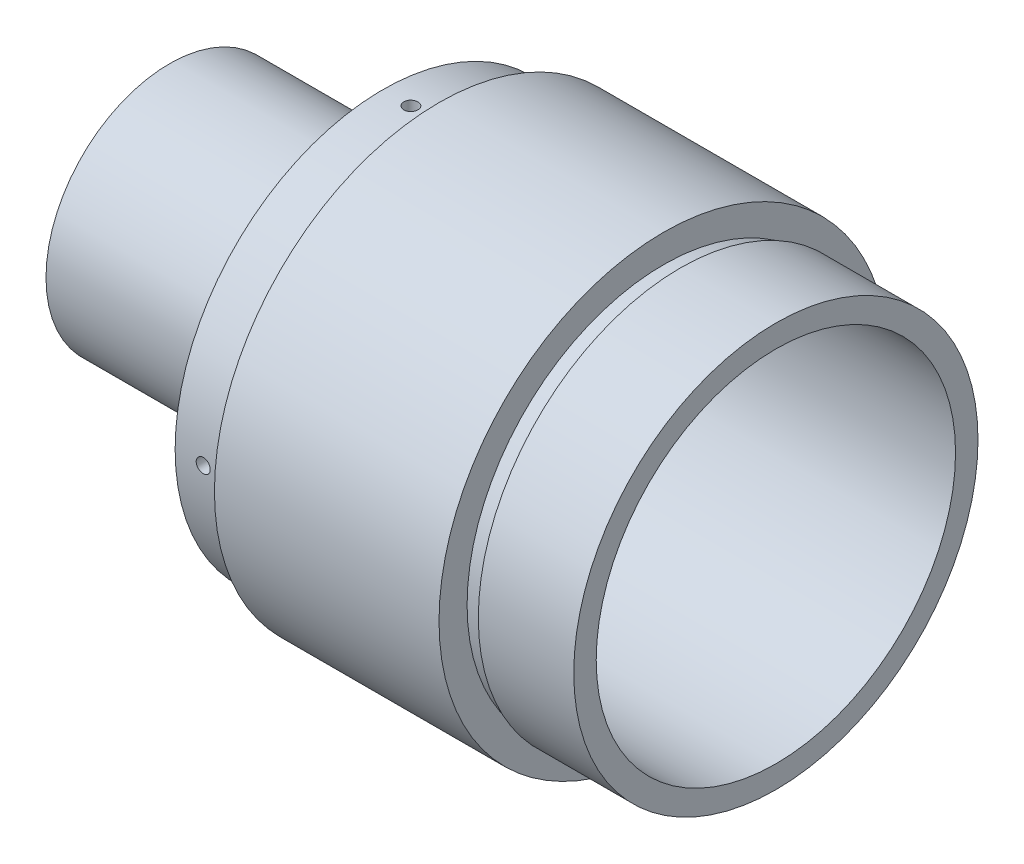
from build123d import *

# Parameters (mm, degrees)
IZIM12_R                = 1.6
KES_EKSTR_ZYON1_DEPTH   = 122.918005233
DAIRESEL_KAPLAMA1_COUNT = 6
KES_EKSTR_ZYON2_START   = 27
IZIM13_R                = 1.25
KES_EKSTR_ZYON2_DEPTH   = 10
DAIRESEL_KAPLAMA2_COUNT = 4


with BuildPart() as part:
    # Çizim1 → Döndür1 (revolve)
    with BuildSketch(Plane.XY):
        Polygon((-60, 40), (-60, 37), (-70, 37), (-70, 22), (-108, 22), (-108, 4), (-106, 4), (-106, 18.2), (-57, 18.2), (-57, 32), (0, 32), (0, 36), (-17, 36), (-17, 35), (-20, 35), (-20, 40), align=None)
    revolve(axis=Axis((-88.99, 0, 0), (1, 0, 0)))

    # Çizim12 → Kes-Ekstrüzyon1 (cut, through all)
    with BuildSketch(Plane(origin=(0, 0, 0), x_dir=(0, 0, -1), z_dir=(1, 0, 0))):
        with Locations((12.5, 0)):
            Circle(IZIM12_R)
    kes_ekstr_zyon1 = extrude(amount=-KES_EKSTR_ZYON1_DEPTH, mode=Mode.SUBTRACT)

    # Dairesel Kaplama1: Kes-Ekstrüzyon1 ×6 about axis
    dairesel_kaplama1_axis = Axis((-88.99, 0, 0), (1, 0, 0))
    for i in range(1, DAIRESEL_KAPLAMA1_COUNT):
        add(kes_ekstr_zyon1.rotate(dairesel_kaplama1_axis, i * 360 / DAIRESEL_KAPLAMA1_COUNT), mode=Mode.SUBTRACT)

    # Çizim13 → Kes-Ekstrüzyon2 (cut)
    with BuildSketch(Plane.XY.offset(KES_EKSTR_ZYON2_START)):
        with Locations((-65, 0)):
            Circle(IZIM13_R)
    kes_ekstr_zyon2 = extrude(amount=KES_EKSTR_ZYON2_DEPTH, mode=Mode.SUBTRACT)

    # Dairesel Kaplama2: Kes-Ekstrüzyon2 ×4 about axis
    dairesel_kaplama2_axis = Axis((-88.99, 0, 0), (1, 0, 0))
    for i in range(1, DAIRESEL_KAPLAMA2_COUNT):
        add(kes_ekstr_zyon2.rotate(dairesel_kaplama2_axis, i * 360 / DAIRESEL_KAPLAMA2_COUNT), mode=Mode.SUBTRACT)


solid = part.part
